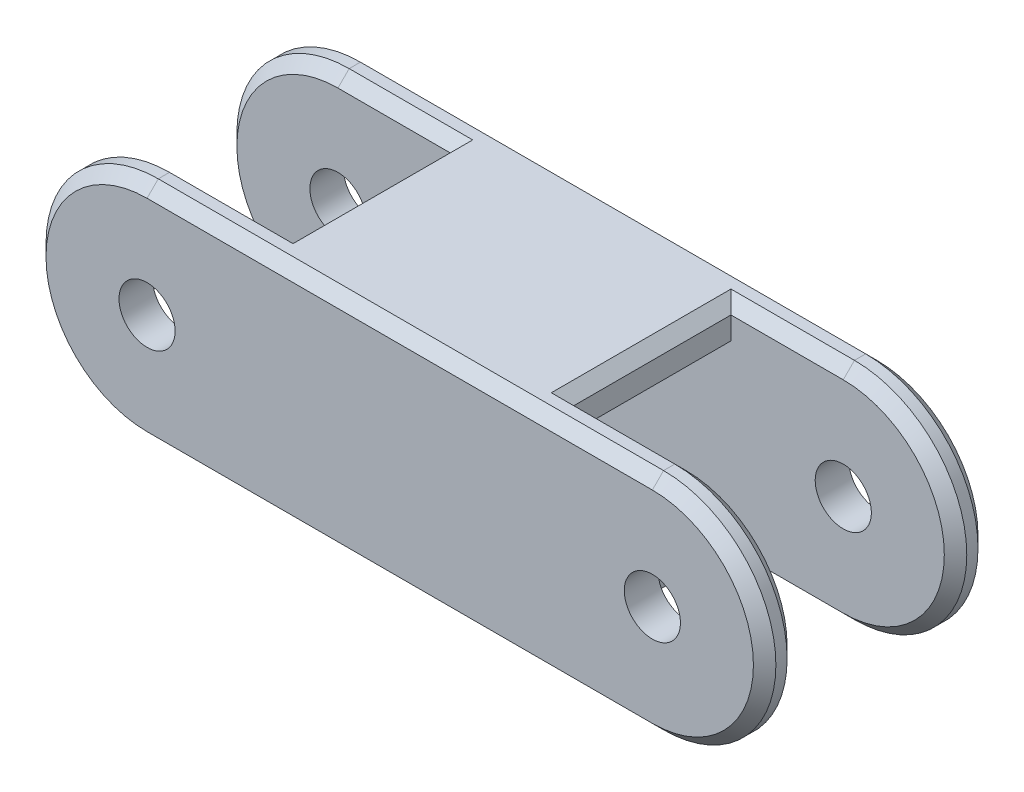
from build123d import *

# Parameters (mm, degrees)
BOSS_EXTRUDE1_DEPTH = 10
CUT_EXTRUDE1_DEPTH  = 7
SKETCH3_R           = 2.5
CUT_EXTRUDE2_DEPTH  = 10
CHAMFER2_SIZE       = 1
CHAMFER3_SIZE       = 1
SHELL1_START        = -7
SHELL1_OUTLINE_W    = 25
SHELL1_OUTLINE_H    = 14
SHELL1_DEPTH        = 14
CHAMFER4_SIZE       = 1


# Read off the part's stored shape, not the designer's step: Shell1
with BuildPart() as part:
    # Sketch1 → Boss-Extrude1 (new, symmetric)
    with BuildSketch(Plane.XY):
        with BuildLine():
            Line((-22.5, 10), (22.5, 10))
            ThreePointArc((22.5, 10), (32.5, 0), (22.5, -10))
            Line((22.5, -10), (-22.5, -10))
            ThreePointArc((-22.5, -10), (-32.5, 0), (-22.5, 10))
        make_face()
    extrude(amount=BOSS_EXTRUDE1_DEPTH, both=True)

    # Sketch2 → Cut-Extrude1 (cut, symmetric)
    with BuildSketch(Plane.XY):
        with BuildLine():
            Line((-22.5, 10), (-12.5, 10))
            Line((-12.5, 10), (-12.5, -10))
            Line((-12.5, -10), (-22.5, -10))
            ThreePointArc((-22.5, -10), (-32.5, 0), (-22.5, 10))
        make_face()
        with BuildLine():
            Line((12.5, -10), (22.5, -10))
            ThreePointArc((22.5, -10), (32.5, 0), (22.5, 10))
            Line((22.5, 10), (12.5, 10))
            Line((12.5, 10), (12.5, -10))
        make_face()
    extrude(amount=CUT_EXTRUDE1_DEPTH, both=True, mode=Mode.SUBTRACT)

    # Sketch3 → Cut-Extrude2 (cut, symmetric)
    with BuildSketch(Plane.XY):
        with Locations((-22.5, 0)):
            Circle(SKETCH3_R)
        with Locations(Location((22.5, 0, 0), (0, 0, 180))):
            Circle(SKETCH3_R)
    extrude(amount=CUT_EXTRUDE2_DEPTH, both=True, mode=Mode.SUBTRACT)

    # Chamfer2
    chamfer2_edges = [part.edges().sort_by_distance(p)[0] for p in [
        (-32.5, 0, -7),
        (-17.5, 10, -7),
        (-17.5, -10, -7),
        (-32.5, 0, 7),
        (-17.5, -10, 7),
        (-17.5, 10, 7),
        (32.5, 0, -7),
        (17.5, -10, -7),
        (17.5, 10, -7),
        (32.5, 0, 7),
        (17.5, 10, 7),
        (17.5, -10, 7),
    ]]
    chamfer(chamfer2_edges, length=CHAMFER2_SIZE)

    # Chamfer3
    chamfer3_edges = [part.edges().sort_by_distance(p)[0] for p in [
        (32.5, 0, 10),
        (0, 10, 10),
        (-32.5, 0, 10),
        (0, 10, -10),
        (32.5, 0, -10),
        (0, -10, -10),
        (-32.5, 0, -10),
        (0, -10, 10),
    ]]
    chamfer(chamfer3_edges, length=CHAMFER3_SIZE)

    # Shell1 outline → Shell1 (cut)
    with BuildSketch(Plane.XY.offset(SHELL1_START)):
        Rectangle(SHELL1_OUTLINE_W, SHELL1_OUTLINE_H)
    extrude(amount=SHELL1_DEPTH, mode=Mode.SUBTRACT)

    # Chamfer4
    chamfer4_edges = [part.edges().sort_by_distance(p)[0] for p in [
        (12.5, -10, 0),
        (12.5, 10, 0),
        (-12.5, -10, 0),
        (-12.5, 10, 0),
    ]]
    chamfer(chamfer4_edges, length=CHAMFER4_SIZE)


solid = part.part
